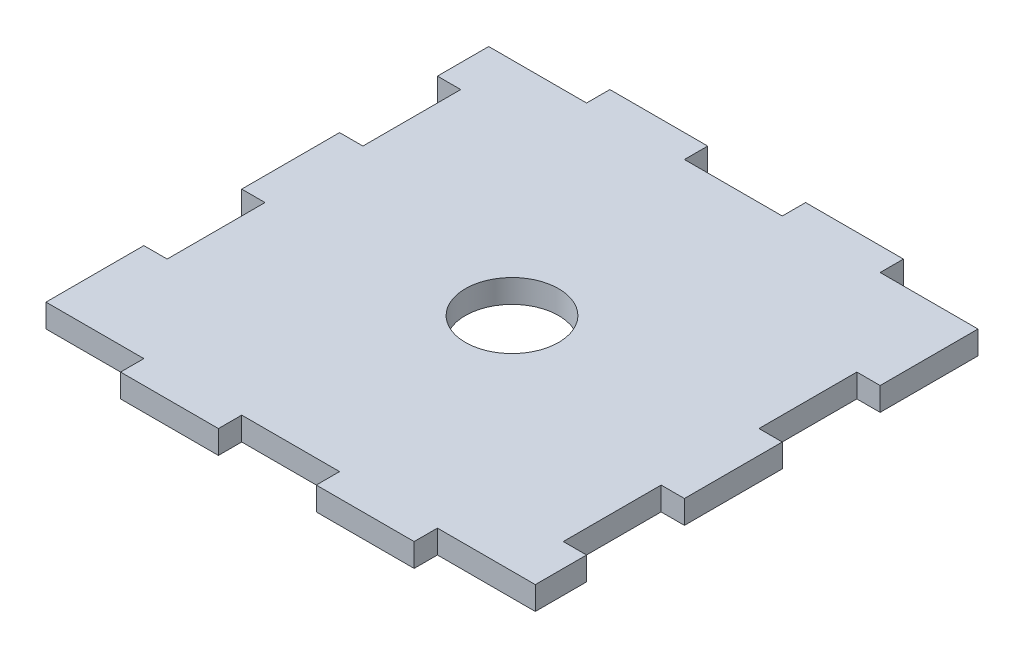
from build123d import *

# Parameters (mm, degrees)
SKETCH1_W           = 100
SKETCH1_H           = 100
BOSS_EXTRUDE1_DEPTH = 4.7625
SKETCH2_W           = 20
SKETCH2_H           = 4.7625
SKETCH2_W_2         = 4.7625
SKETCH2_H_2         = 20
CUT_EXTRUDE1_DEPTH  = 4.7625
SKETCH3_R           = 9.525
CUT_EXTRUDE2_DEPTH  = 71.870878407


with BuildPart() as part:
    # Sketch1 → Boss-Extrude1 (new body)
    with BuildSketch(Plane(origin=(0, 0, 0), x_dir=(1, 0, 0), z_dir=(0, 1, 0))):
        Rectangle(SKETCH1_W, SKETCH1_H)
    extrude(amount=BOSS_EXTRUDE1_DEPTH)

    # Sketch2 → Cut-Extrude1 (cut)
    with BuildSketch(Plane(origin=(0, 4.7625, 0), x_dir=(1, 0, 0), z_dir=(0, 1, 0))):
        with Locations((-40, -47.61875)):
            Rectangle(SKETCH2_W, SKETCH2_H)
        with Locations((-47.61875, -15.2375)):
            Rectangle(SKETCH2_W_2, SKETCH2_H_2)
        with Locations((0, -47.61875)):
            Rectangle(SKETCH2_W, SKETCH2_H)
        with Locations((-47.61875, 24.7625)):
            Rectangle(SKETCH2_W_2, SKETCH2_H_2)
        with Locations((40, -47.61875)):
            Rectangle(SKETCH2_W, SKETCH2_H)
        with Locations((-40, 47.61875)):
            Rectangle(SKETCH2_W, SKETCH2_H)
        with Locations((47.61875, -24.7625)):
            Rectangle(SKETCH2_W_2, SKETCH2_H_2)
        with Locations((0, 47.61875)):
            Rectangle(SKETCH2_W, SKETCH2_H)
        with Locations((47.61875, 15.2375)):
            Rectangle(SKETCH2_W_2, SKETCH2_H_2)
        with Locations((40, 47.61875)):
            Rectangle(SKETCH2_W, SKETCH2_H)
    extrude(amount=-CUT_EXTRUDE1_DEPTH, mode=Mode.SUBTRACT)

    # Sketch3 → Cut-Extrude2 (cut, through all)
    with BuildSketch(Plane(origin=(0, 4.7625, 0), x_dir=(1, 0, 0), z_dir=(0, 1, 0))):
        Circle(SKETCH3_R)
    extrude(amount=-CUT_EXTRUDE2_DEPTH, mode=Mode.SUBTRACT)


solid = part.part
